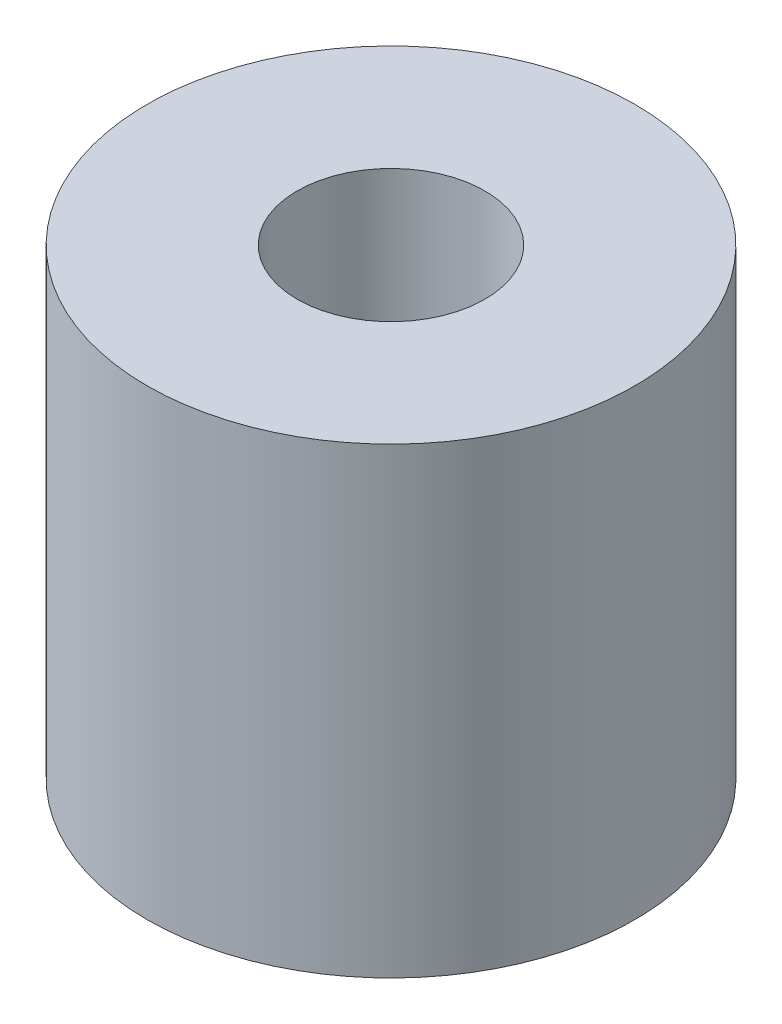
from build123d import *

# Parameters (mm, degrees)
SKETCH1_R           = 5
SKETCH1_R_2         = 1.575
BOSS_EXTRUDE1_DEPTH = 9.48
CUT_EXTRUDE1_START  = -4
SKETCH2_R           = 1.925
SKETCH2_R_2         = 1.575
CUT_EXTRUDE1_DEPTH  = 4


with BuildPart() as part:
    # Sketch1 → Boss-Extrude1 (new body)
    with BuildSketch(Plane(origin=(0, 0, 0), x_dir=(1, 0, 0), z_dir=(0, 1, 0))):
        Circle(SKETCH1_R)
        Circle(SKETCH1_R_2, mode=Mode.SUBTRACT)
    extrude(amount=BOSS_EXTRUDE1_DEPTH)

    # Sketch2 → Cut-Extrude1 (cut)
    with BuildSketch(Plane(origin=(0, 9.48, 0), x_dir=(1, 0, 0), z_dir=(0, 1, 0)).offset(CUT_EXTRUDE1_START)):
        Circle(SKETCH2_R)
        Circle(SKETCH2_R_2, mode=Mode.SUBTRACT)
    extrude(amount=CUT_EXTRUDE1_DEPTH, mode=Mode.SUBTRACT)


solid = part.part
